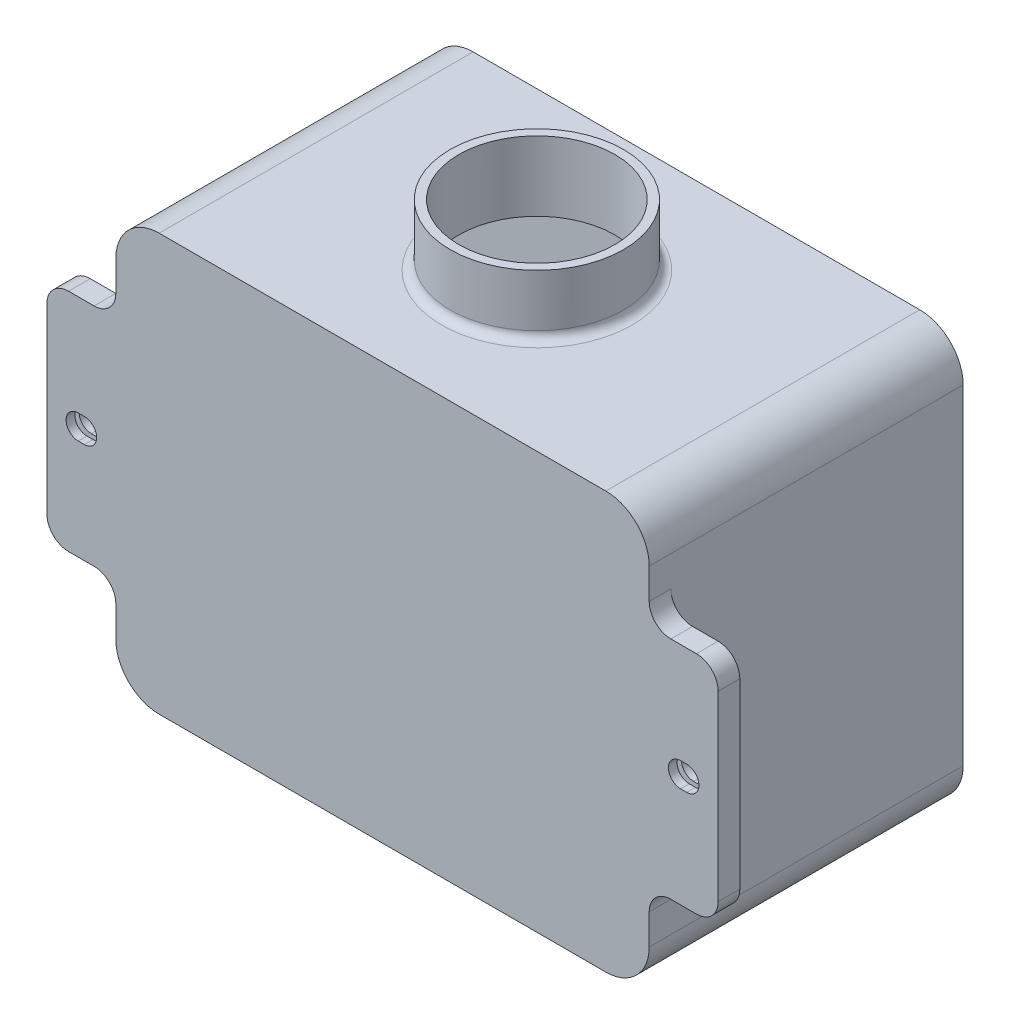
from build123d import *

# Parameters (mm, degrees)
SKETCH1_W           = 156.21
SKETCH1_H           = 139.874625
BOSS_EXTRUDE1_DEPTH = 91.948
BOSS_EXTRUDE2_DEPTH = 6.35
SKETCH4_R           = 25.4
BOSS_EXTRUDE3_DEPTH = 17.859375
SKETCH5_W           = 156.21
SKETCH5_H           = 17.859375
CUT_EXTRUDE2_DEPTH  = 254.874905946
FILLET2_R           = 12.7
SHELL3_START        = 2.54
SHELL3_DEPTH        = 86.868
SHELL3_START_2      = 88.138
SHELL3_2_DEPTH      = 1.27
SHELL3_START_3      = 137.334625
SHELL3_3_OUTLINE_R  = 22.86
SHELL3_3_DEPTH      = 20.399375
FILLET3_R           = 6.35
SKETCH9_W           = 1.7859375
SKETCH9_H           = 7.14375
CUT_EXTRUDE3_DEPTH  = 254.874905946
FILLET4_R           = 2.54


with BuildPart() as part:
    # Sketch1 → Boss-Extrude1 (new body)
    with BuildSketch(Plane.XY):
        with Locations((78.105, 69.9373125)):
            Rectangle(SKETCH1_W, SKETCH1_H)
    extrude(amount=BOSS_EXTRUDE1_DEPTH)

    # Sketch3 → Boss-Extrude2 (add)
    with BuildSketch(Plane.XY.offset(91.948)):
        with BuildLine():
            Line((0, 111.887), (-13.843, 111.887))
            ThreePointArc((-13.843, 111.887), (-18.333128061, 110.027128061), (-20.193, 105.537))
            Line((-20.193, 105.537), (-20.193, 52.197))
            ThreePointArc((-20.193, 52.197), (-18.333128061, 47.706871939), (-13.843, 45.847))
            Line((-13.843, 45.847), (0, 45.847))
            Line((0, 45.847), (0, 111.887))
        make_face()
        with BuildLine():
            Line((156.21, 111.887), (170.053, 111.887))
            ThreePointArc((170.053, 111.887), (174.543128061, 110.027128061), (176.403, 105.537))
            Line((176.403, 105.537), (176.403, 52.197))
            ThreePointArc((176.403, 52.197), (174.543128061, 47.706871939), (170.053, 45.847))
            Line((170.053, 45.847), (156.21, 45.847))
            Line((156.21, 45.847), (156.21, 111.887))
        make_face()
    extrude(amount=-BOSS_EXTRUDE2_DEPTH)

    # Sketch4 → Boss-Extrude3 (add)
    with BuildSketch(Plane(origin=(0, 139.874625, 0), x_dir=(1, 0, 0), z_dir=(0, 1, 0))):
        with Locations(Location((77.343, -45.974, 0), (0, 0, 270))):
            Circle(SKETCH4_R)
    extrude(amount=BOSS_EXTRUDE3_DEPTH)

    # Sketch5 → Cut-Extrude2 (cut, through all)
    with BuildSketch(Plane.XY.offset(91.948)):
        with Locations((78.105, 8.9296875)):
            Rectangle(SKETCH5_W, SKETCH5_H)
    extrude(amount=-CUT_EXTRUDE2_DEPTH, mode=Mode.SUBTRACT)

    # Sketch6 → Revolve1 (revolve)
    with BuildSketch(Plane(origin=(0, 0, 45.974), x_dir=(-1, 0, 0), z_dir=(0, 0, -1)), mode=Mode.PRIVATE) as revolve1_sk:
        Polygon((-78.105, 17.859375), (-78.105, 0), (-81.28, 0), (-83.732198932, 2.205295997), (-81.28, 2.205295997), (-83.732198932, 5.846722634), (-81.28, 5.846722634), (-84.791652888, 11.509375), (-87.63, 11.509375), (-87.63, 17.859375), align=None)
    revolve(revolve1_sk.sketch.rotate(Axis((78.105, 17.859375, 45.974), (0, -1, 0)), 90), axis=Axis((78.105, 17.859375, 45.974), (0, -1, 0)))

    # Fillet2
    fillet2_edges = [part.edges().sort_by_distance(p)[0] for p in [
        (0, 17.859375, 45.974),
        (156.21, 17.859375, 45.974),
        (0, 139.874625, 45.974),
        (156.21, 139.874625, 45.974),
    ]]
    fillet(fillet2_edges, radius=FILLET2_R)

    # Shell3: read off the stored shape, not the designer's step
    # Shell3 outline → Shell3 (cut)
    with BuildSketch(Plane.XY.offset(SHELL3_START)):
        with BuildLine():
            ThreePointArc((12.7, 137.334625), (5.515795103, 134.358829897), (2.54, 127.174625))
            Line((2.54, 127.174625), (2.54, 30.559375))
            ThreePointArc((2.54, 30.559375), (5.515795103, 23.375170103), (12.7, 20.399375))
            Line((12.7, 20.399375), (143.51, 20.399375))
            ThreePointArc((143.51, 20.399375), (150.694204897, 23.375170103), (153.67, 30.559375))
            Line((153.67, 30.559375), (153.67, 127.174625))
            ThreePointArc((153.67, 127.174625), (150.694204897, 134.358829897), (143.51, 137.334625))
            Line((143.51, 137.334625), (12.7, 137.334625))
        make_face()
    extrude(amount=SHELL3_DEPTH, mode=Mode.SUBTRACT)

    # Shell3 2 outline → Shell3 2 (cut)
    with BuildSketch(Plane.XY.offset(SHELL3_START_2)):
        with BuildLine():
            Line((2.54, 48.387), (2.54, 109.347))
            Line((2.54, 109.347), (-13.843, 109.347))
            ThreePointArc((-13.843, 109.347), (-16.537076836, 108.231076836), (-17.653, 105.537))
            Line((-17.653, 105.537), (-17.653, 52.197))
            ThreePointArc((-17.653, 52.197), (-16.537076836, 49.502923164), (-13.843, 48.387))
            Line((-13.843, 48.387), (2.54, 48.387))
        make_face()
        with BuildLine():
            Line((170.053, 109.347), (153.67, 109.347))
            Line((153.67, 109.347), (153.67, 48.387))
            Line((153.67, 48.387), (170.053, 48.387))
            ThreePointArc((170.053, 48.387), (172.747076836, 49.502923164), (173.863, 52.197))
            Line((173.863, 52.197), (173.863, 105.537))
            ThreePointArc((173.863, 105.537), (172.747076836, 108.231076836), (170.053, 109.347))
        make_face()
    extrude(amount=SHELL3_2_DEPTH, mode=Mode.SUBTRACT)

    # Shell3 3 outline → Shell3 3 (cut)
    with BuildSketch(Plane(origin=(0, 0, 0), x_dir=(1, 0, 0), z_dir=(0, 1, 0)).offset(SHELL3_START_3)):
        with Locations((77.343, -45.974)):
            Circle(SHELL3_3_OUTLINE_R)
    extrude(amount=SHELL3_3_DEPTH, mode=Mode.SUBTRACT)

    # Shell3 4 outline → Shell3 4 (revolve, cut)
    with BuildSketch(Plane(origin=(78.105, 0, 45.974), x_dir=(1, 0, 0), z_dir=(0, 0, 1))):
        Polygon((0, 20.399375), (0, 5.546418432), (5.273046986, 14.049375), (6.985, 14.049375), (6.985, 20.399375), align=None)
        Polygon((0.854475277, 3.306722634), (0, 3.306722634), (0, 2.037857783), align=None)
    revolve(axis=Axis((78.105, 0, 45.974), (0, 1, 0)), mode=Mode.SUBTRACT)

    # Fillet3
    fillet3_edges = [part.edges().sort_by_distance(p)[0] for p in [
        (0, 111.887, 88.773),
        (0, 45.847, 88.773),
        (156.21, 45.847, 88.773),
        (156.21, 111.887, 88.773),
    ]]
    fillet(fillet3_edges, radius=FILLET3_R)

    # Sketch9 → Cut-Extrude3 (cut, through all)
    with BuildSketch(Plane.XY.offset(91.948)):
        with BuildLine():
            Line((-10.98946875, 82.438875), (-10.98946875, 75.295125))
            ThreePointArc((-10.98946875, 75.295125), (-14.56134375, 78.867), (-10.98946875, 82.438875))
        make_face()
        with BuildLine():
            ThreePointArc((-9.20353125, 82.438875), (-5.63165625, 78.867), (-9.20353125, 75.295125))
            Line((-9.20353125, 75.295125), (-9.20353125, 82.438875))
        make_face()
        with Locations((-10.0965, 78.867)):
            Rectangle(SKETCH9_W, SKETCH9_H)
        with BuildLine():
            Line((165.41353125, 82.438875), (165.41353125, 75.295125))
            ThreePointArc((165.41353125, 75.295125), (161.84165625, 78.867), (165.41353125, 82.438875))
        make_face()
        with BuildLine():
            ThreePointArc((167.19946875, 82.438875), (170.77134375, 78.867), (167.19946875, 75.295125))
            Line((167.19946875, 75.295125), (167.19946875, 82.438875))
        make_face()
        with Locations((166.3065, 78.867)):
            Rectangle(SKETCH9_W, SKETCH9_H)
    extrude(amount=-CUT_EXTRUDE3_DEPTH, mode=Mode.SUBTRACT)

    # Fillet4
    fillet4_edges = [part.edges().sort_by_distance(p)[0] for p in [
        (77.343, 139.874625, 20.574),
    ]]
    fillet(fillet4_edges, radius=FILLET4_R)


solid = part.part
